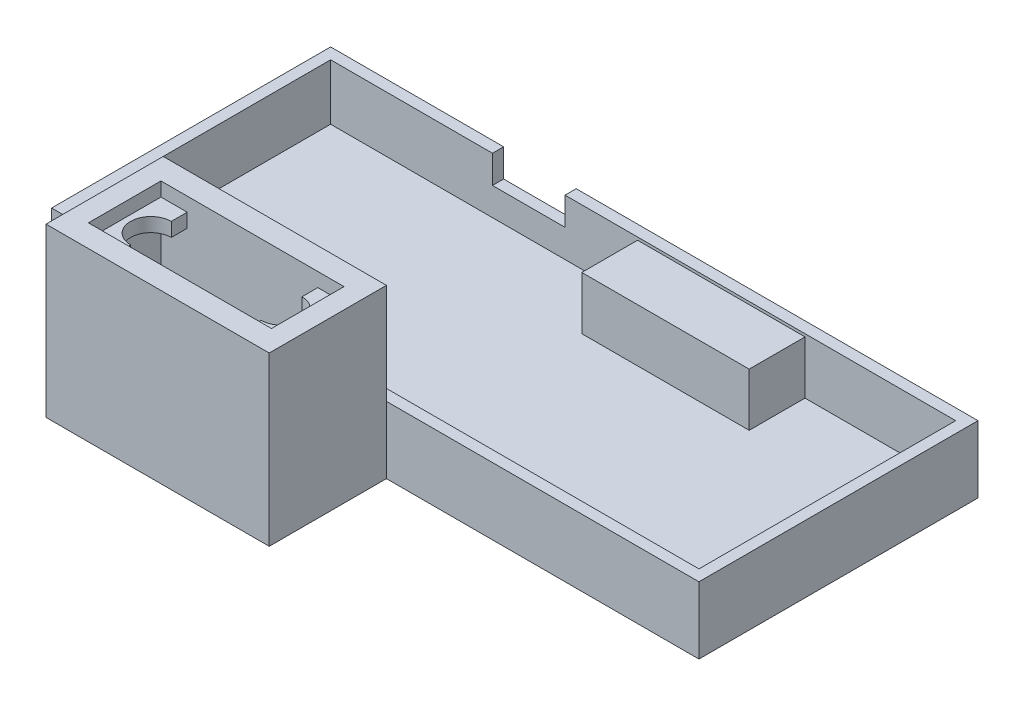
from build123d import *

# Parameters (mm, degrees)
SKETCH1_W               = 116
SKETCH1_H               = 50
BOSS_EXTRUDE1_DEPTH     = 2
SKETCH2_W               = 116
SKETCH2_H               = 50
SKETCH2_W_2             = 112
SKETCH2_H_2             = 46
BOSS_EXTRUDE3_DEPTH     = 10
SKETCH5_W               = 13
SKETCH5_H               = 5
CUT_EXTRUDE2_DEPTH      = 9.5
SKETCH4_W               = 30
SKETCH4_H               = 10
BOSS_EXTRUDE5_DEPTH     = 9.5
SKETCH6_W               = 40
SKETCH6_H               = 21
SKETCH6_W_2             = 23.4
SKETCH6_H_2             = 13
BOSS_EXTRUDE6_DEPTH     = 30
SKETCH7_W               = 4.7
SKETCH7_H               = 13
SKETCH7_R               = 1.25
CUT_EXTRUDE3_DEPTH      = 2.5
CUT_EXTRUDE4_DEPTH      = 130.830658937
CUT_EXTRUDE4_DEPTH_BACK = 130.830658937
SKETCH8_R               = 1.25
CUT_EXTRUDE5_DEPTH      = 130.275867818
CUT_EXTRUDE5_DEPTH_BACK = 130.275867818
SKETCH10_W              = 32.8
SKETCH10_H              = 13
CUT_EXTRUDE6_DEPTH      = 25
CUT_EXTRUDE7_DEPTH      = 130.275867818
CUT_EXTRUDE7_DEPTH_BACK = 130.275867818
CUT_EXTRUDE8_DEPTH      = 10


with BuildPart() as part:
    # Sketch1 → Boss-Extrude1 (new body)
    with BuildSketch(Plane(origin=(0, 0, 0), x_dir=(1, 0, 0), z_dir=(0, 1, 0))):
        with Locations((58, 25)):
            Rectangle(SKETCH1_W, SKETCH1_H)
    extrude(amount=BOSS_EXTRUDE1_DEPTH)

    # Sketch2 → Boss-Extrude3 (add)
    with BuildSketch(Plane(origin=(0, 2, 0), x_dir=(1, 0, 0), z_dir=(0, 1, 0))):
        with Locations((58, 25)):
            Rectangle(SKETCH2_W, SKETCH2_H)
        with Locations((58, 25)):
            Rectangle(SKETCH2_W_2, SKETCH2_H_2, mode=Mode.SUBTRACT)
    extrude(amount=BOSS_EXTRUDE3_DEPTH)

    # Sketch5 → Cut-Extrude2 (cut)
    with BuildSketch(Plane(origin=(0, 0, -50), x_dir=(-1, 0, 0), z_dir=(0, 0, -1))):
        with Locations((-37.5, 9.5)):
            Rectangle(SKETCH5_W, SKETCH5_H)
    extrude(amount=-CUT_EXTRUDE2_DEPTH, mode=Mode.SUBTRACT)

    # Sketch4 → Boss-Extrude5 (add)
    with BuildSketch(Plane(origin=(0, 2, 0), x_dir=(1, 0, 0), z_dir=(0, 1, 0))):
        with Locations((72, 43)):
            Rectangle(SKETCH4_W, SKETCH4_H)
    extrude(amount=BOSS_EXTRUDE5_DEPTH)

    # Sketch6 → Boss-Extrude6 (add)
    with BuildSketch(Plane.XZ):
        with Locations((40, 10.5)):
            Rectangle(SKETCH6_W, SKETCH6_H)
        with Locations((40, 10.5)):
            Rectangle(SKETCH6_W_2, SKETCH6_H_2, mode=Mode.SUBTRACT)
    extrude(amount=-BOSS_EXTRUDE6_DEPTH)

    # Sketch7 → Cut-Extrude3 (cut)
    # profile 1 of 2: a face of its own
    with BuildSketch(Plane(origin=(0, 30, 0), x_dir=(1, 0, 0), z_dir=(0, 1, 0))):
        with Locations((54.05, -10.5)):
            Rectangle(SKETCH7_W, SKETCH7_H)
        with Locations((54.1, -10.5)):
            Circle(SKETCH7_R, mode=Mode.SUBTRACT)
    # profile 2 of 2: a face of its own
    with BuildSketch(Plane(origin=(0, 30, 0), x_dir=(1, 0, 0), z_dir=(0, 1, 0))):
        with Locations((25.95, -10.5)):
            Rectangle(SKETCH7_W, SKETCH7_H)
        with Locations((25.9, -10.5)):
            Circle(SKETCH7_R, mode=Mode.SUBTRACT)
    extrude(amount=-CUT_EXTRUDE3_DEPTH, mode=Mode.SUBTRACT)

    # Sketch8 → Cut-Extrude4 (cut, two sides: drawn at the far end of the back side and taken through both)
    with BuildSketch(Plane(origin=(0, 30, 0), x_dir=(1, 0, 0), z_dir=(0, 1, 0)).offset(-CUT_EXTRUDE4_DEPTH_BACK)):
        with Locations((54.1, -10.5)):
            Circle(SKETCH8_R)
        with Locations((25.9, -10.5)):
            Circle(SKETCH8_R)
    extrude(amount=CUT_EXTRUDE4_DEPTH + CUT_EXTRUDE4_DEPTH_BACK, mode=Mode.SUBTRACT)

    # Sketch9 → Cut-Extrude5 (cut, two sides: drawn at the far end of the back side and taken through both)
    with BuildSketch(Plane(origin=(0, 27.5, 0), x_dir=(1, 0, 0), z_dir=(0, 1, 0)).offset(-CUT_EXTRUDE5_DEPTH_BACK)):
        with BuildLine():
            Line((51.7, -13.126196774), (51.7, -7.873803226))
            ThreePointArc((51.7, -7.873803226), (55.35, -10.5), (51.7, -13.126196774))
        make_face()
    extrude(amount=CUT_EXTRUDE5_DEPTH + CUT_EXTRUDE5_DEPTH_BACK, mode=Mode.SUBTRACT)

    # Sketch10 → Cut-Extrude6 (cut)
    with BuildSketch(Plane.XZ):
        with Locations((40, 10.5)):
            Rectangle(SKETCH10_W, SKETCH10_H)
    extrude(amount=-CUT_EXTRUDE6_DEPTH, mode=Mode.SUBTRACT)

    # Sketch11 → Cut-Extrude7 (cut, two sides: drawn at the far end of the back side and taken through both)
    with BuildSketch(Plane(origin=(0, 27.5, 0), x_dir=(1, 0, 0), z_dir=(0, 1, 0)).offset(-CUT_EXTRUDE7_DEPTH_BACK)):
        with BuildLine():
            Line((51.7, -14.15), (51.7, -6.85))
            ThreePointArc((51.7, -6.85), (55.35, -10.5), (51.7, -14.15))
        make_face()
        with BuildLine():
            Line((28.3, -14.15), (28.3, -6.85))
            ThreePointArc((28.3, -6.85), (24.65, -10.5), (28.3, -14.15))
        make_face()
    extrude(amount=CUT_EXTRUDE7_DEPTH + CUT_EXTRUDE7_DEPTH_BACK, mode=Mode.SUBTRACT)

    # Sketch12 → Cut-Extrude8 (cut)
    with BuildSketch(Plane.ZY.offset(-20)):
        with BuildLine():
            Line((4, 0), (17, 0))
            Line((17, 0), (17, 3.5))
            ThreePointArc((17, 3.5), (10.5, 10), (4, 3.5))
            Line((4, 3.5), (4, 0))
        make_face()
    extrude(amount=-CUT_EXTRUDE8_DEPTH, mode=Mode.SUBTRACT)


solid = part.part
